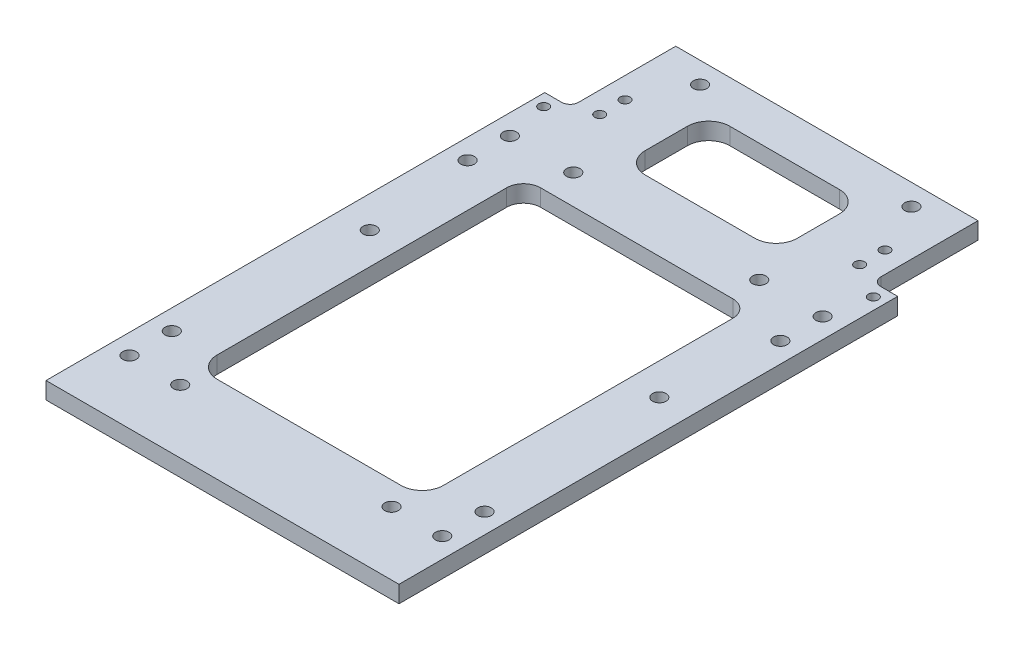
from build123d import *
from build123d.topology import SkipClean

# Parameters (mm, degrees)
EXTRUDE_1_DEPTH           = 130
HOLE_WIZARD_2_2_2_2_1_D   = 2.2
HOLE_WIZARD_2_2_2_2_2_D   = 2.2
CUT_EXTRUDE_1_DEPTH       = 12
CUT_EXTRUDE_5_DEPTH       = 20
HOLE_WIZARD_2_35_2_35_1_D = 2.35
CUT_EXTRUDE_6_DEPTH       = 10
SKETCH1_W                 = 22.455844123
SKETCH1_H                 = 22.319185646
EXTRUDE1_DEPTH            = 165
SKETCH3_W                 = 71.514718625
SKETCH3_H                 = 3
EXTRUDE3_DEPTH            = 13
SKETCH4_R                 = 1.6
EXTRUDE4_DEPTH            = 13
SKETCH6_R                 = 1.6
EXTRUDE5_DEPTH            = 13
SKETCH_21_R               = 1.6
CUT_EXTRUDE_7_DEPTH       = 10
SKETCH_22_W               = 43.5
SKETCH_22_H               = 65.5
CUT_EXTRUDE_8_DEPTH       = 10
EXTRUDE_3_DEPTH           = 3
FILLET_1_R                = 10
CUT_EXTRUDE_9_DEPTH       = 10
EXTRUDE_START             = -3
SKETCH_25_R               = 1.1
EXTRUDE_4_DEPTH           = 3
FILLET_2_R                = 5
SKETCH_26_W               = 35.953284367
SKETCH_26_H               = 20
CUT_EXTRUDE_10_DEPTH      = 3
FILLET_3_R                = 5
SKETCH_27_R               = 1.6
CUT_EXTRUDE_11_DEPTH      = 3
EXTRUDE_5_DEPTH           = 3
CUT_EXTRUDE_12_DEPTH      = 3
FILLET_4_R                = 4
SKETCH_30_R               = 1.6
CUT_EXTRUDE_13_DEPTH      = 3
SKETCH_31_R               = 1.6
CUT_EXTRUDE_14_DEPTH      = 10
SKETCH_32_W               = 2
SKETCH_32_H               = 20
EXTRUDE_6_DEPTH           = 3
FILLET_5_R                = 5
SKETCH_33_R               = 1.6
CUT_EXTRUDE_15_DEPTH      = 3
SKETCH_34_R               = 1.6
EXTRUDE_7_DEPTH           = 3
EXTRUDE_START_2           = 1
SKETCH_37_R               = 1.175
SKETCH_37_R_2             = 1.6
EXTRUDE_8_DEPTH           = 1
FILLET_6_R                = 2


with BuildPart() as part:
    # 草图1 → 凸台-拉伸1 (new body)
    with BuildSketch(Plane.XY):
        Polygon((21.213203436, 21.213203436), (107.213203436, 21.213203436), (115.213203436, 13.213203436), (110.970562748, 13.213203436), (105.970562748, 18.213203436), (22.455844123, 18.213203436), (17.455844123, 13.213203436), (13.213203436, 13.213203436), align=None)
    extrude(amount=EXTRUDE_1_DEPTH)

    # Ø2.2 (2.2) 直径孔1 (through all)
    with Locations(Plane(origin=(0, 0, 0), x_dir=(0, 0, 1), z_dir=(-0.7071067811865488, 0.7071067811865462, 0))):
        with Locations((65, 25), (25, 25), (105, 25)):
            hole_wizard_2_2_2_2_1 = Hole(HOLE_WIZARD_2_2_2_2_1_D / 2)

    # 镜向1: Ø2.2 (2.2) 直径孔1 across plane
    add(hole_wizard_2_2_2_2_1.mirror(Plane(origin=(64.213203436, 0, 0), x_dir=(0, 0, 1), z_dir=(1, 0, 0))), mode=Mode.SUBTRACT)

    # Ø2.2 (2.2) 直径孔2 (through all)
    with Locations(Plane(origin=(0, 21.213203436, 0), x_dir=(1, 0, 0), z_dir=(0, 1, 0))):
        with Locations((39.213203436, -115), (39.213203436, -75), (89.213203436, -75), (89.213203436, -115)):
            Hole(HOLE_WIZARD_2_2_2_2_2_D / 2)

    # 草图6 → 切除-拉伸1 (cut)
    with BuildSketch(Plane(origin=(0, 0, 0), x_dir=(-1, 0, 0), z_dir=(0, 0, -1))):
        Polygon((-99.970562748, 21.213203436), (-107.213203436, 21.213203436), (-105.970562748, 18.213203436), (-99.970562748, 18.213203436), align=None)
        Polygon((-105.970562748, 18.213203436), (-107.213203436, 21.213203436), (-115.213203436, 13.213203436), (-113.091883092, 11.091883092), align=None)
    cut_extrude_1 = extrude(amount=-CUT_EXTRUDE_1_DEPTH, mode=Mode.SUBTRACT)

    # 草图14 → 切除-拉伸5 (cut)
    with BuildSketch(Plane.XY.offset(130)):
        Polygon((103.970562748, 18.213203436), (103.970562748, 21.213203436), (107.213203436, 21.213203436), (115.213203436, 13.213203436), (110.970562748, 13.213203436), (105.970562748, 18.213203436), align=None)
    cut_extrude_5 = extrude(amount=-CUT_EXTRUDE_5_DEPTH, mode=Mode.SUBTRACT)

    # Ø2.35 (2.35) 直径孔1 (through all)
    with Locations(Plane(origin=(0, 21.213203436, 0), x_dir=(1, 0, 0), z_dir=(0, 1, 0))):
        with Locations((94.970562748, -4), (103.213203436, -15), (94.970562748, -10)):
            hole_wizard_2_35_2_35_1 = Hole(HOLE_WIZARD_2_35_2_35_1_D / 2)

    # 镜向2: 切除-拉伸1, 切除-拉伸5, Ø2.35 (2.35) 直径孔1 across plane
    add(cut_extrude_1.mirror(Plane(origin=(64.213203436, 0, 0), x_dir=(0, 0, 1), z_dir=(1, 0, 0))), mode=Mode.SUBTRACT)
    add(cut_extrude_5.mirror(Plane(origin=(64.213203436, 0, 0), x_dir=(0, 0, 1), z_dir=(1, 0, 0))), mode=Mode.SUBTRACT)
    add(hole_wizard_2_35_2_35_1.mirror(Plane(origin=(64.213203436, 0, 0), x_dir=(0, 0, 1), z_dir=(1, 0, 0))), mode=Mode.SUBTRACT)

    # 草图15 → 切除-拉伸6 (cut)
    with BuildSketch(Plane(origin=(0, 21.213203436, 0), x_dir=(1, 0, 0), z_dir=(0, 1, 0))):
        with BuildLine():
            Line((27.213203436, -18), (101.213203436, -18))
            ThreePointArc((101.213203436, -18), (102.713203436, -19.5), (101.213203436, -21))
            Line((101.213203436, -21), (27.213203436, -21))
            ThreePointArc((27.213203436, -21), (25.713203436, -19.5), (27.213203436, -18))
        make_face()
        with BuildLine():
            Line((27.213203436, -29), (101.213203436, -29))
            ThreePointArc((101.213203436, -29), (102.713203436, -30.5), (101.213203436, -32))
            Line((101.213203436, -32), (27.213203436, -32))
            ThreePointArc((27.213203436, -32), (25.713203436, -30.5), (27.213203436, -29))
        make_face()
        with BuildLine():
            Line((27.213203436, -40), (101.213203436, -40))
            ThreePointArc((101.213203436, -40), (102.713203436, -41.5), (101.213203436, -43))
            Line((101.213203436, -43), (27.213203436, -43))
            ThreePointArc((27.213203436, -43), (25.713203436, -41.5), (27.213203436, -40))
        make_face()
        with BuildLine():
            Line((27.213203436, -51), (101.213203436, -51))
            ThreePointArc((101.213203436, -51), (102.713203436, -52.5), (101.213203436, -54))
            Line((101.213203436, -54), (27.213203436, -54))
            ThreePointArc((27.213203436, -54), (25.713203436, -52.5), (27.213203436, -51))
        make_face()
        with BuildLine():
            Line((27.213203436, -62), (101.213203436, -62))
            ThreePointArc((101.213203436, -62), (102.713203436, -63.5), (101.213203436, -65))
            Line((101.213203436, -65), (27.213203436, -65))
            ThreePointArc((27.213203436, -65), (25.713203436, -63.5), (27.213203436, -62))
        make_face()
        with BuildLine():
            Line((27.213203436, -77.5), (101.213203436, -77.5))
            ThreePointArc((101.213203436, -77.5), (102.713203436, -79), (101.213203436, -80.5))
            Line((101.213203436, -80.5), (27.213203436, -80.5))
            ThreePointArc((27.213203436, -80.5), (25.713203436, -79), (27.213203436, -77.5))
        make_face()
        with BuildLine():
            Line((27.213203436, -91.5), (101.213203436, -91.5))
            ThreePointArc((101.213203436, -91.5), (102.713203436, -93), (101.213203436, -94.5))
            Line((101.213203436, -94.5), (27.213203436, -94.5))
            ThreePointArc((27.213203436, -94.5), (25.713203436, -93), (27.213203436, -91.5))
        make_face()
        with BuildLine():
            Line((27.213203436, -105.5), (101.213203436, -105.5))
            ThreePointArc((101.213203436, -105.5), (102.713203436, -107), (101.213203436, -108.5))
            Line((101.213203436, -108.5), (27.213203436, -108.5))
            ThreePointArc((27.213203436, -108.5), (25.713203436, -107), (27.213203436, -105.5))
        make_face()
    extrude(amount=-CUT_EXTRUDE_6_DEPTH, mode=Mode.SUBTRACT)

    # Sketch1 → Extrude1 (cut)
    with BuildSketch(Plane(origin=(0, 0, 12), x_dir=(-1, 0, 0), z_dir=(0, 0, -1))):
        Polygon((-105.970562748, 18.213203436), (-105.970562748, 28.355826894), (-119.630928902, 28.355826894), (-119.630928902, 18.213203436), (-119.630928902, 5.364047477), (-105.970562748, 5.364047477), align=None)
        with Locations((-11.227922062, 17.196234071)):
            Rectangle(SKETCH1_W, SKETCH1_H)
    extrude(amount=-EXTRUDE1_DEPTH, mode=Mode.SUBTRACT)

    # Sketch3 → Extrude3 (add)
    with BuildSketch(Plane(origin=(0, 0, 0), x_dir=(-1, 0, 0), z_dir=(0, 0, -1))):
        with Locations((-64.213203436, 19.713203436)):
            Rectangle(SKETCH3_W, SKETCH3_H)
    extrude(amount=EXTRUDE3_DEPTH)

    # Sketch4 → Extrude4 (cut)
    with BuildSketch(Plane(origin=(0, 21.213203436, 0), x_dir=(1, 0, 0), z_dir=(0, 1, 0))):
        with Locations(Location((89.213203436, 8, 0), (0, 0, 180))):
            Circle(SKETCH4_R)
        with Locations(Location((39.213203436, 8, 0), (0, 0, 180))):
            Circle(SKETCH4_R)
    extrude(amount=-EXTRUDE4_DEPTH, mode=Mode.SUBTRACT)

    # Sketch6 → Extrude5 (cut)
    with BuildSketch(Plane(origin=(0, 21.213203436, 0), x_dir=(1, 0, 0), z_dir=(0, 1, 0))):
        with Locations(Location((101.213203436, -25, 0), (0, 0, 180))):
            Circle(SKETCH6_R)
        with Locations(Location((101.213203436, -47, 0), (0, 0, 180))):
            Circle(SKETCH6_R)
        with Locations(Location((101.213203436, -71.25, 0), (0, 0, 180))):
            Circle(SKETCH6_R)
        with Locations(Location((101.213203436, -100, 0), (0, 0, 180))):
            Circle(SKETCH6_R)
        with Locations(Location((27.213203436, -100, 0), (0, 0, 180))):
            Circle(SKETCH6_R)
        with Locations(Location((27.213203436, -71.25, 0), (0, 0, 180))):
            Circle(SKETCH6_R)
        with Locations(Location((27.213203436, -47, 0), (0, 0, 180))):
            Circle(SKETCH6_R)
        with Locations(Location((27.213203436, -25, 0), (0, 0, 180))):
            Circle(SKETCH6_R)
    extrude(amount=-EXTRUDE5_DEPTH, mode=Mode.SUBTRACT)

    # 草图21 → 切除-拉伸7 (cut)
    with BuildSketch(Plane(origin=(0, 21.213203436, 0), x_dir=(1, 0, 0), z_dir=(0, 1, 0))):
        with Locations(Location((86.213203436, -25, 0), (0, 0, 180))):
            Circle(SKETCH_21_R)
        with Locations(Location((42.213203436, -25, 0), (0, 0, 270))):
            Circle(SKETCH_21_R)
    extrude(amount=-CUT_EXTRUDE_7_DEPTH, mode=Mode.SUBTRACT)

    # 草图22 → 切除-拉伸8 (cut)
    with BuildSketch(Plane(origin=(0, 21.213203436, 0), x_dir=(1, 0, 0), z_dir=(0, 1, 0))):
        with Locations((64.213203436, -61.75)):
            Rectangle(SKETCH_22_W, SKETCH_22_H)
    extrude(amount=-CUT_EXTRUDE_8_DEPTH, mode=Mode.SUBTRACT)

    # 草图23 → 凸台-拉伸3 (add)
    with BuildSketch(Plane(origin=(0, 21.213203436, 0), x_dir=(1, 0, 0), z_dir=(0, 1, 0))):
        with BuildLine():
            Line((101.213203436, -91.5), (85.963203436, -91.5))
            Line((85.963203436, -91.5), (42.463203436, -91.5))
            Line((42.463203436, -91.5), (27.213203436, -91.5))
            ThreePointArc((27.213203436, -91.5), (25.713203436, -93), (27.213203436, -94.5))
            Line((27.213203436, -94.5), (101.213203436, -94.5))
            ThreePointArc((101.213203436, -94.5), (102.713203436, -93), (101.213203436, -91.5))
        make_face()
        with BuildLine():
            Line((27.213203436, -32), (42.463203436, -32))
            Line((42.463203436, -32), (85.963203436, -32))
            Line((85.963203436, -32), (101.213203436, -32))
            ThreePointArc((101.213203436, -32), (102.713203436, -30.5), (101.213203436, -29))
            Line((101.213203436, -29), (27.213203436, -29))
            ThreePointArc((27.213203436, -29), (25.713203436, -30.5), (27.213203436, -32))
        make_face()
        with BuildLine():
            Line((101.213203436, -18), (27.213203436, -18))
            ThreePointArc((27.213203436, -18), (25.713203436, -19.5), (27.213203436, -21))
            Line((27.213203436, -21), (101.213203436, -21))
            ThreePointArc((101.213203436, -21), (102.713203436, -19.5), (101.213203436, -18))
        make_face()
        with BuildLine():
            Line((101.213203436, -105.5), (27.213203436, -105.5))
            ThreePointArc((27.213203436, -105.5), (25.713203436, -107), (27.213203436, -108.5))
            Line((27.213203436, -108.5), (101.213203436, -108.5))
            ThreePointArc((101.213203436, -108.5), (102.713203436, -107), (101.213203436, -105.5))
        make_face()
    extrude(amount=-EXTRUDE_3_DEPTH)

    # 圆角1
    # the kernel refuses this fillet: 10 mm, written as the material it adds along each edge
    with BuildSketch(Plane(origin=(42.463203436, 21.213203436, 32), x_dir=(0, 0, 1), z_dir=(0, -1, 0)), Plane(origin=(85.963203436, 18.213203436, 32), x_dir=(0, 0, 1), z_dir=(0, 1, 0))) as fillet_1_piece_1:
        with BuildLine():
            CenterArc((10, -9.797958971), FILLET_1_R, 101.536959033, 78.463040967)
            Line((0, -9.797958971), (-0.2, -9.797958971))
            Line((-0.2, -9.797958971), (-0.2, 0))
            Line((-0.2, 0), (0, 0.2))
            ThreePointArc((0, 0.2), (4, 0.2), (7.96, 0.195959179))
            Line((7.96, 0.195959179), (8, 0))
        make_face()
    extrude(amount=3)
    with BuildSketch(Plane(origin=(85.963203436, 21.213203436, 91.5), x_dir=(0, 0, -1), z_dir=(0, -1, 0)), Plane(origin=(42.463203436, 18.213203436, 91.5), x_dir=(0, 0, -1), z_dir=(0, 1, 0))) as fillet_1_piece_2:
        with BuildLine():
            CenterArc((FILLET_1_R, -FILLET_1_R), FILLET_1_R, 90, 90)
            Line((0, -FILLET_1_R), (-FILLET_1_R * 0.02, -FILLET_1_R))
            Line((-FILLET_1_R * 0.02, -FILLET_1_R), (-FILLET_1_R * 0.02, FILLET_1_R * 0.02))
            Line((-FILLET_1_R * 0.02, FILLET_1_R * 0.02), (FILLET_1_R, FILLET_1_R * 0.02))
            Line((FILLET_1_R, FILLET_1_R * 0.02), (FILLET_1_R, 0))
        make_face()
    extrude(amount=3)

    # 草图24 → 切除-拉伸9 (cut)
    with BuildSketch(Plane(origin=(0, 21.213203436, 0), x_dir=(1, 0, 0), z_dir=(0, 1, 0))):
        with BuildLine():
            Line((25.713203436, -52.5), (25.713203436, -63.5))
            ThreePointArc((25.713203436, -63.5), (26.152543264, -64.560660172), (27.213203436, -65))
            Line((27.213203436, -65), (101.213203436, -65))
            ThreePointArc((101.213203436, -65), (102.273863607, -64.560660172), (102.713203436, -63.5))
            Line((102.713203436, -63.5), (102.713203436, -52.5))
            ThreePointArc((102.713203436, -52.5), (102.273863607, -51.439339828), (101.213203436, -51))
            Line((101.213203436, -51), (27.213203436, -51))
            ThreePointArc((27.213203436, -51), (26.152543264, -51.439339828), (25.713203436, -52.5))
        make_face()
    extrude(amount=-CUT_EXTRUDE_9_DEPTH, mode=Mode.SUBTRACT)

    # 草图25 → 凸台-拉伸4 (add)
    with BuildSketch(Plane(origin=(0, 21.213203436, 0), x_dir=(1, 0, 0), z_dir=(0, 1, 0)).offset(EXTRUDE_START)):
        with Locations((39.213203436, -75)):
            Circle(SKETCH_25_R)
        with Locations((89.213203436, -75)):
            Circle(SKETCH_25_R)
    extrude(amount=EXTRUDE_4_DEPTH)

    # 圆角2
    # the kernel refuses this fillet: 5 mm, written as the material it takes off along each edge
    with BuildSketch(Plane(origin=(85.963203436, 33.713203436, 77.5), x_dir=(1, 0, 0), z_dir=(0, -1, 0)), Plane(origin=(85.963203436, 33.713203436, 51), x_dir=(1, 0, 0), z_dir=(0, -1, 0)), Plane(origin=(42.463203436, 33.713203436, 65), x_dir=(-1, 0, 0), z_dir=(0, -1, 0)), Plane(origin=(42.463203436, 33.713203436, 43), x_dir=(-1, 0, 0), z_dir=(0, -1, 0))) as fillet_2_piece_1:
        with BuildLine():
            CenterArc((FILLET_2_R, -FILLET_2_R), FILLET_2_R, 90, 90)
            Line((0, -FILLET_2_R), (0, 0))
            Line((0, 0), (FILLET_2_R, 0))
        make_face()
    extrude(amount=28, mode=Mode.SUBTRACT)
    with BuildSketch(Plane(origin=(85.963203436, 5.713203436, 65), x_dir=(0, 0, 1), z_dir=(0, 1, 0)), Plane(origin=(85.963203436, 5.713203436, 43), x_dir=(0, 0, 1), z_dir=(0, 1, 0)), Plane(origin=(42.463203436, 5.713203436, 77.5), x_dir=(0, 0, -1), z_dir=(0, 1, 0)), Plane(origin=(42.463203436, 5.713203436, 51), x_dir=(0, 0, -1), z_dir=(0, 1, 0))) as fillet_2_piece_2:
        with BuildLine():
            CenterArc((FILLET_2_R, FILLET_2_R), FILLET_2_R, 180, 90)
            Line((0, FILLET_2_R), (0, 0))
            Line((0, 0), (FILLET_2_R, 0))
        make_face()
    extrude(amount=28, mode=Mode.SUBTRACT)

    # 草图26 → 切除-拉伸10 (cut)
    with BuildSketch(Plane(origin=(0, 21.213203436, 0), x_dir=(1, 0, 0), z_dir=(0, 1, 0))):
        with Locations((64.213203436, -7)):
            Rectangle(SKETCH_26_W, SKETCH_26_H)
    extrude(amount=-CUT_EXTRUDE_10_DEPTH, mode=Mode.SUBTRACT)

    # 圆角3
    fillet_3_edges = [part.edges().sort_by_distance(p)[0] for p in [
        (82.189845619, 19.713203436, -3),
        (82.189845619, 19.713203436, 17),
        (46.236561252, 19.713203436, 17),
        (46.236561252, 19.713203436, -3),
    ]]
    fillet(fillet_3_edges, radius=FILLET_3_R)

    # 草图27 → 切除-拉伸11 (cut)
    with BuildSketch(Plane(origin=(0, 21.213203436, 0), x_dir=(1, 0, 0), z_dir=(0, 1, 0))):
        with Locations(Location((27.213203436, -90, 0), (0, 0, 180))):
            Circle(SKETCH_27_R)
        with Locations(Location((27.213203436, -35, 0), (0, 0, 180))):
            Circle(SKETCH_27_R)
        with Locations((101.213203436, -90)):
            Circle(SKETCH_27_R)
        with Locations((101.213203436, -35)):
            Circle(SKETCH_27_R)
    extrude(amount=-CUT_EXTRUDE_11_DEPTH, mode=Mode.SUBTRACT)

    # 草图28 → 凸台-拉伸5 (add)
    with BuildSketch(Plane(origin=(0, 21.213203436, 0), x_dir=(1, 0, 0), z_dir=(0, 1, 0))):
        Polygon((42.463203436, -40), (42.463203436, -80.5), (42.463203436, -83.552465137), (23.442871373, -83.552465137), (23.442871373, -40), (25.473566538, -40), align=None)
        Polygon((85.963203436, -83.552465137), (85.963203436, -80.5), (85.963203436, -40), (102.952840334, -40), (104.983535498, -40), (104.983535498, -83.552465137), align=None)
    extrude(amount=-EXTRUDE_5_DEPTH)

    # 草图29 → 切除-拉伸12 (cut)
    with BuildSketch(Plane(origin=(0, 21.213203436, 0), x_dir=(1, 0, 0), z_dir=(0, 1, 0))):
        Polygon((52.261162407, -32), (37.461162407, -32), (37.461162407, -91.5), (37.461162407, -109.5), (90.965244464, -109.5), (90.965244464, -91.5), (90.965244464, -32), (76.165244464, -32), align=None)
    extrude(amount=-CUT_EXTRUDE_12_DEPTH, mode=Mode.SUBTRACT)

    # 圆角4
    fillet_4_edges = [part.edges().sort_by_distance(p)[0] for p in [
        (37.461162407, 19.713203436, 32),
        (90.965244464, 19.713203436, 32),
    ]]
    fillet(fillet_4_edges, radius=FILLET_4_R)

    # 草图30 → 切除-拉伸13 (cut)
    with BuildSketch(Plane(origin=(0, 21.213203436, 0), x_dir=(1, 0, 0), z_dir=(0, 1, 0))):
        with Locations(Location((29.958503265, -60.9, 0), (0, 0, 180))):
            Circle(SKETCH_30_R)
        with Locations(Location((98.467903606, -60.9, 0), (0, 0, 180))):
            Circle(SKETCH_30_R)
    extrude(amount=-CUT_EXTRUDE_13_DEPTH, mode=Mode.SUBTRACT)

    # 草图31 → 切除-拉伸14 (cut)
    with BuildSketch(Plane(origin=(0, 21.213203436, 0), x_dir=(1, 0, 0), z_dir=(0, 1, 0))):
        with Locations(Location((39.213203436, -115, 0), (0, 0, 180))):
            Circle(SKETCH_31_R)
        with Locations(Location((89.213203436, -115, 0), (0, 0, 180))):
            Circle(SKETCH_31_R)
    extrude(amount=-CUT_EXTRUDE_14_DEPTH, mode=Mode.SUBTRACT)

    # 草图32 → 凸台-拉伸6 (add)
    with BuildSketch(Plane(origin=(0, 21.213203436, 0), x_dir=(1, 0, 0), z_dir=(0, 1, 0))):
        with Locations((23.455844123, -120)):
            Rectangle(SKETCH_32_W, SKETCH_32_H)
        with Locations((104.970562748, -120)):
            Rectangle(SKETCH_32_W, SKETCH_32_H)
    extrude(amount=-EXTRUDE_6_DEPTH)

    # 圆角5
    fillet_5_edges = [part.edges().sort_by_distance(p)[0] for p in [
        (90.965244464, 19.713203436, 109.5),
        (37.461162407, 19.713203436, 109.5),
    ]]
    fillet(fillet_5_edges, radius=FILLET_5_R)

    # 草图33 → 切除-拉伸15 (cut)
    with BuildSketch(Plane(origin=(0, 21.213203436, 0), x_dir=(1, 0, 0), z_dir=(0, 1, 0))):
        with Locations(Location((27.213203436, -115, 0), (0, 0, 180))):
            Circle(SKETCH_33_R)
        with Locations(Location((27.213203436, -105, 0), (0, 0, 180))):
            Circle(SKETCH_33_R)
        with Locations((101.213203436, -105)):
            Circle(SKETCH_33_R)
        with Locations((101.213203436, -115)):
            Circle(SKETCH_33_R)
    extrude(amount=-CUT_EXTRUDE_15_DEPTH, mode=Mode.SUBTRACT)

    # 草图34 → 凸台-拉伸7 (add)
    with BuildSketch(Plane(origin=(0, 21.213203436, 0), x_dir=(1, 0, 0), z_dir=(0, 1, 0))):
        with Locations((101.213203436, -100)):
            Circle(SKETCH_34_R)
        with Locations((101.213203436, -90)):
            Circle(SKETCH_34_R)
        with Locations((27.213203436, -90)):
            Circle(SKETCH_34_R)
        with Locations((27.213203436, -100)):
            Circle(SKETCH_34_R)
    extrude(amount=-EXTRUDE_7_DEPTH)

    # 草图37 → 凸台-拉伸8 (add)
    with SkipClean():  # the faces are left unmerged after this step: merging them gives an invalid solid
        with BuildSketch(Plane(origin=(0, 21.213203436, 0), x_dir=(1, 0, 0), z_dir=(0, 1, 0)).offset(EXTRUDE_START_2)):
            Polygon((99.970562748, 13), (28.455844123, 13), (28.455844123, -12), (22.455844123, -12), (22.455844123, -130), (105.970562748, -130), (105.970562748, -12), (99.970562748, -12), align=None)
            with Locations(Location((25.213203436, -15, 0), (0, 0, 270))):
                Circle(SKETCH_37_R, mode=Mode.SUBTRACT)
            with Locations(Location((103.213203436, -15, 0), (0, 0, 270))):
                Circle(SKETCH_37_R, mode=Mode.SUBTRACT)
            with Locations(Location((94.970562748, -10, 0), (0, 0, 270))):
                Circle(SKETCH_37_R, mode=Mode.SUBTRACT)
            with Locations(Location((94.970562748, -4, 0), (0, 0, 270))):
                Circle(SKETCH_37_R, mode=Mode.SUBTRACT)
            with Locations(Location((33.455844123, -4, 0), (0, 0, 270))):
                Circle(SKETCH_37_R, mode=Mode.SUBTRACT)
            with Locations(Location((33.455844123, -10, 0), (0, 0, 270))):
                Circle(SKETCH_37_R, mode=Mode.SUBTRACT)
            with Locations(Location((39.213203436, 8, 0), (0, 0, 180))):
                Circle(SKETCH_37_R_2, mode=Mode.SUBTRACT)
            with Locations(Location((89.213203436, 8, 0), (0, 0, 180))):
                Circle(SKETCH_37_R_2, mode=Mode.SUBTRACT)
            with Locations(Location((101.213203436, -25, 0), (0, 0, 180))):
                Circle(SKETCH_37_R_2, mode=Mode.SUBTRACT)
            with Locations(Location((27.213203436, -25, 0), (0, 0, 180))):
                Circle(SKETCH_37_R_2, mode=Mode.SUBTRACT)
            with Locations(Location((42.213203436, -25, 0), (0, 0, 180))):
                Circle(SKETCH_37_R_2, mode=Mode.SUBTRACT)
            with Locations(Location((86.213203436, -25, 0), (0, 0, 180))):
                Circle(SKETCH_37_R_2, mode=Mode.SUBTRACT)
            with Locations(Location((101.213203436, -35, 0), (0, 0, 180))):
                Circle(SKETCH_37_R_2, mode=Mode.SUBTRACT)
            with Locations(Location((27.213203436, -35, 0), (0, 0, 180))):
                Circle(SKETCH_37_R_2, mode=Mode.SUBTRACT)
            with Locations(Location((29.958503265, -60.9, 0), (0, 0, 180))):
                Circle(SKETCH_37_R_2, mode=Mode.SUBTRACT)
            with Locations(Location((98.467903606, -60.9, 0), (0, 0, 180))):
                Circle(SKETCH_37_R_2, mode=Mode.SUBTRACT)
            with Locations(Location((89.213203436, -115, 0), (0, 0, 180))):
                Circle(SKETCH_37_R_2, mode=Mode.SUBTRACT)
            with Locations(Location((39.213203436, -115, 0), (0, 0, 180))):
                Circle(SKETCH_37_R_2, mode=Mode.SUBTRACT)
            with Locations(Location((27.213203436, -115, 0), (0, 0, 180))):
                Circle(SKETCH_37_R_2, mode=Mode.SUBTRACT)
            with Locations(Location((27.213203436, -105, 0), (0, 0, 180))):
                Circle(SKETCH_37_R_2, mode=Mode.SUBTRACT)
            with Locations(Location((101.213203436, -105, 0), (0, 0, 180))):
                Circle(SKETCH_37_R_2, mode=Mode.SUBTRACT)
            with Locations(Location((101.213203436, -115, 0), (0, 0, 180))):
                Circle(SKETCH_37_R_2, mode=Mode.SUBTRACT)
            with BuildLine():
                Line((77.189845619, 3), (51.236561252, 3))
                ThreePointArc((51.236561252, 3), (47.701027346, 1.535533906), (46.236561252, -2))
                Line((46.236561252, -2), (46.236561252, -12))
                ThreePointArc((46.236561252, -12), (47.701027346, -15.535533906), (51.236561252, -17))
                Line((51.236561252, -17), (77.189845619, -17))
                ThreePointArc((77.189845619, -17), (80.725379525, -15.535533906), (82.189845619, -12))
                Line((82.189845619, -12), (82.189845619, -2))
                ThreePointArc((82.189845619, -2), (80.725379525, 1.535533906), (77.189845619, 3))
            make_face(mode=Mode.SUBTRACT)
            with BuildLine():
                Line((37.461162407, -36), (37.461162407, -104.5))
                ThreePointArc((37.461162407, -104.5), (38.925628501, -108.035533906), (42.461162407, -109.5))
                Line((42.461162407, -109.5), (85.965244464, -109.5))
                ThreePointArc((85.965244464, -109.5), (89.50077837, -108.035533906), (90.965244464, -104.5))
                Line((90.965244464, -104.5), (90.965244464, -36))
                ThreePointArc((90.965244464, -36), (89.793671589, -33.171572875), (86.965244464, -32))
                Line((86.965244464, -32), (41.461162407, -32))
                ThreePointArc((41.461162407, -32), (38.632735282, -33.171572875), (37.461162407, -36))
            make_face(mode=Mode.SUBTRACT)
        extrude(amount=-EXTRUDE_8_DEPTH)

    # 圆角6
    fillet_6_edges = [part.edges().sort_by_distance(p)[0] for p in [
        (28.455844123, 19.713203436, 12),
        (99.970562748, 19.713203436, 12),
    ]]
    fillet(fillet_6_edges, radius=FILLET_6_R)


solid = part.part
